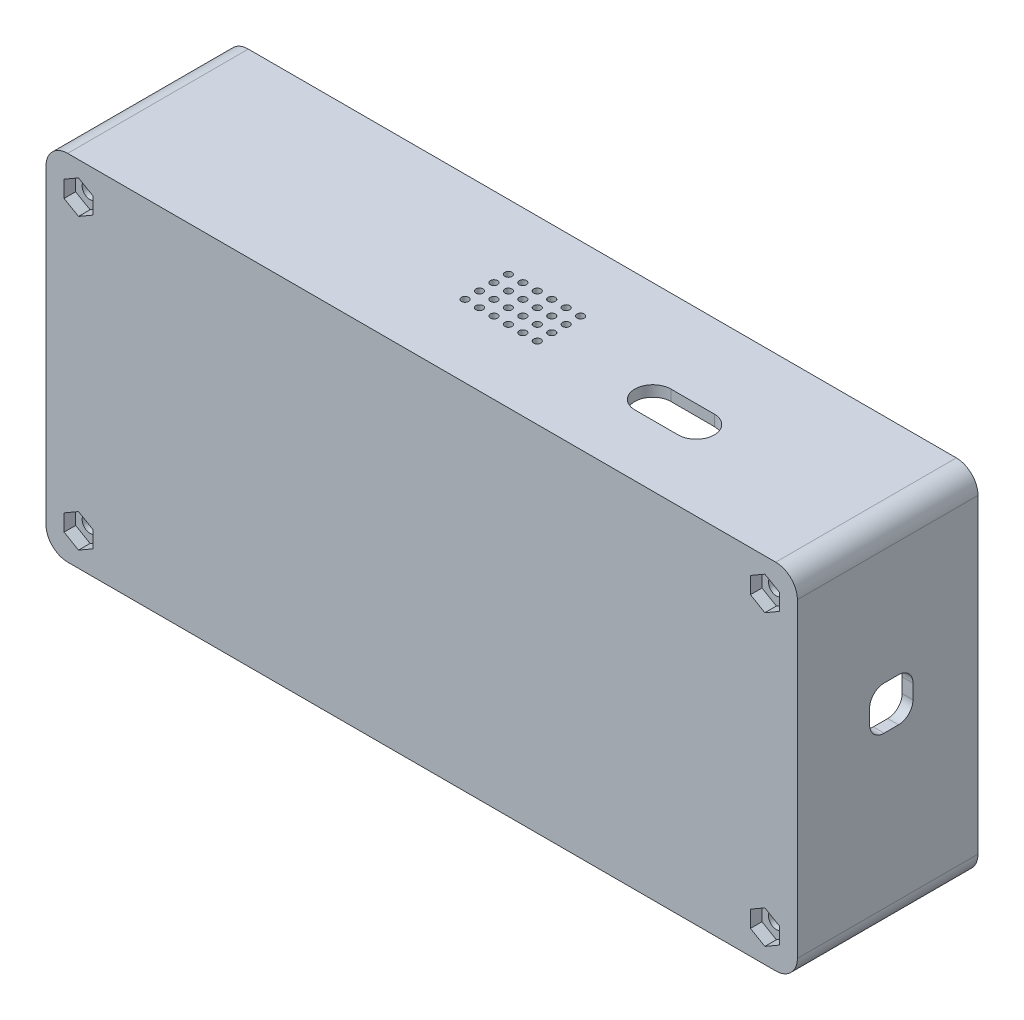
from build123d import *

# Parameters (mm, degrees)
SKETCH_1_W                  = 104
SKETCH_1_H                  = 49
SKETCH_1_R                  = 1.1
EXTRUDE_1_DEPTH             = 25
FILLET_1_R                  = 3
CUT_EXTRUDE_1_DEPTH         = 1.6
SHELL_2_DEPTH               = 23.5
SHELL_2_2_OUTLINE_R         = 2.6
SHELL_2_2_DEPTH             = 21.9
SKETCH_3_R                  = 2.6
SKETCH_3_R_2                = 1.1
CUT_EXTRUDE_2_DEPTH         = 17
CUT_EXTRUDE_3_DEPTH         = 17
CUT_EXTRUDE_4_DEPTH         = 110.732629605
CUT_EXTRUDE_4_DEPTH_BACK    = 110.732629605
SKETCH_6_W                  = 6
SKETCH_6_H                  = 6
SKETCH_7_W                  = 15
SKETCH_7_H                  = 7
CUT_EXTRUDE_5_DEPTH         = 17
SKETCH_8_W                  = 10
SKETCH_8_H                  = 2
EXTRUDE_2_DEPTH             = 3
FILLET_3_R                  = 2
FILLET_4_R                  = 2
SKETCH_10_R                 = 0.5
CUT_EXTRUDE_6_DEPTH         = 76.696763471
PATTERN_LINEAR_1_COUNT      = 4
PATTERN_LINEAR_1_PITCH      = 2
PATTERN_LINEAR_1_COUNT_DIR2 = 6
PATTERN_LINEAR_1_PITCH_DIR2 = 2


# Read off the part's stored shape, not the designer's step: 抽壳2
with BuildPart() as part:
    # 草图1 → 凸台-拉伸1 (new body)
    with BuildSketch(Plane.XY):
        Rectangle(SKETCH_1_W, SKETCH_1_H)
        with Locations((-47.5, 20)):
            Circle(SKETCH_1_R, mode=Mode.SUBTRACT)
        with Locations((47.5, 20)):
            Circle(SKETCH_1_R, mode=Mode.SUBTRACT)
        with Locations((47.5, -20)):
            Circle(SKETCH_1_R, mode=Mode.SUBTRACT)
        with Locations((-47.5, -20)):
            Circle(SKETCH_1_R, mode=Mode.SUBTRACT)
    extrude(amount=EXTRUDE_1_DEPTH)

    # 圆角1
    fillet_1_edges = [part.edges().sort_by_distance(p)[0] for p in [
        (-52, 24.5, 12.5),
        (52, 24.5, 12.5),
        (52, -24.5, 12.5),
        (-52, -24.5, 12.5),
    ]]
    fillet(fillet_1_edges, radius=FILLET_1_R)

    # 草图2 → 切除-拉伸1 (cut)
    with BuildSketch(Plane.XY.offset(25)):
        Polygon((-45.5, 18.845299462), (-45.5, 21.154700538), (-47.5, 22.309401077), (-49.5, 21.154700538), (-49.5, 18.845299462), (-47.5, 17.690598923), align=None)
        Polygon((-45.5, -18.845299462), (-45.5, -21.154700538), (-47.5, -22.309401077), (-49.5, -21.154700538), (-49.5, -18.845299462), (-47.5, -17.690598923), align=None)
        Polygon((49.5, 21.154700538), (49.5, 18.845299462), (47.5, 17.690598923), (45.5, 18.845299462), (45.5, 21.154700538), (47.5, 22.309401077), align=None)
        Polygon((49.5, -18.845299462), (47.5, -17.690598923), (45.5, -18.845299462), (45.5, -21.154700538), (47.5, -22.309401077), (49.5, -21.154700538), align=None)
    extrude(amount=-CUT_EXTRUDE_1_DEPTH, mode=Mode.SUBTRACT)

    # 抽壳2 outline → 抽壳2 (cut)
    with BuildSketch(Plane.XY):
        Polygon((-50.5, 17.690598923), (-50.5, -17.690598923), (-47.5, -15.958548116), (-44, -17.979274058), (-44, -22.020725942), (-45.696152423, -23), (45.696152423, -23), (44, -22.020725942), (44, -17.979274058), (47.5, -15.958548116), (50.5, -17.690598923), (50.5, 17.690598923), (47.5, 15.958548116), (44, 17.979274058), (44, 22.020725942), (45.696152423, 23), (-45.696152423, 23), (-44, 22.020725942), (-44, 17.979274058), (-47.5, 15.958548116), align=None)
        with BuildLine():
            Line((-49.396038713, -22.946773423), (-50.054923182, -22.566366298))
            ThreePointArc((-50.054923182, -22.566366298), (-49.75, -22.799038106), (-49.396038713, -22.946773423))
        make_face()
        with BuildLine():
            ThreePointArc((-49.396038713, 22.946773423), (-49.75, 22.799038106), (-50.054923182, 22.566366298))
            Line((-50.054923182, 22.566366298), (-49.396038713, 22.946773423))
        make_face()
        with BuildLine():
            Line((50.054923182, -22.566366298), (49.396038713, -22.946773423))
            ThreePointArc((49.396038713, -22.946773423), (49.75, -22.799038106), (50.054923182, -22.566366298))
        make_face()
        with BuildLine():
            ThreePointArc((50.054923182, 22.566366298), (49.75, 22.799038106), (49.396038713, 22.946773423))
            Line((49.396038713, 22.946773423), (50.054923182, 22.566366298))
        make_face()
    extrude(amount=SHELL_2_DEPTH, mode=Mode.SUBTRACT)

    # Shell 2 2 outline → Shell 2 2 (cut)
    # profile 1 of 4: a face of its own
    with BuildSketch(Plane.XY):
        with BuildLine():
            Line((-50.5, -17.690598923), (-50.5, -21.5))
            ThreePointArc((-50.5, -21.5), (-50.38426601, -22.077760862), (-50.054923182, -22.566366298))
            Line((-50.054923182, -22.566366298), (-49.396038713, -22.946773423))
            ThreePointArc((-49.396038713, -22.946773423), (-49.199799731, -22.986633804), (-49, -23))
            Line((-49, -23), (-45.696152423, -23))
            Line((-45.696152423, -23), (-44, -22.020725942))
            Line((-44, -22.020725942), (-44, -17.979274058))
            Line((-44, -17.979274058), (-47.5, -15.958548116))
            Line((-47.5, -15.958548116), (-50.5, -17.690598923))
        make_face()
        with Locations((-47.5, -20)):
            Circle(SHELL_2_2_OUTLINE_R, mode=Mode.SUBTRACT)
    # profile 2 of 4: a face of its own
    with BuildSketch(Plane.XY):
        with BuildLine():
            Line((-50.5, 21.5), (-50.5, 17.690598923))
            Line((-50.5, 17.690598923), (-47.5, 15.958548116))
            Line((-47.5, 15.958548116), (-44, 17.979274058))
            Line((-44, 17.979274058), (-44, 22.020725942))
            Line((-44, 22.020725942), (-45.696152423, 23))
            Line((-45.696152423, 23), (-49, 23))
            ThreePointArc((-49, 23), (-49.199799731, 22.986633804), (-49.396038713, 22.946773423))
            Line((-49.396038713, 22.946773423), (-50.054923182, 22.566366298))
            ThreePointArc((-50.054923182, 22.566366298), (-50.38426601, 22.077760862), (-50.5, 21.5))
        make_face()
        with Locations((-47.5, 20)):
            Circle(SHELL_2_2_OUTLINE_R, mode=Mode.SUBTRACT)
    # profile 3 of 4: a face of its own
    with BuildSketch(Plane.XY):
        with BuildLine():
            Line((44, -22.020725942), (45.696152423, -23))
            Line((45.696152423, -23), (49, -23))
            ThreePointArc((49, -23), (49.199799731, -22.986633804), (49.396038713, -22.946773423))
            Line((49.396038713, -22.946773423), (50.054923182, -22.566366298))
            ThreePointArc((50.054923182, -22.566366298), (50.38426601, -22.077760862), (50.5, -21.5))
            Line((50.5, -21.5), (50.5, -17.690598923))
            Line((50.5, -17.690598923), (47.5, -15.958548116))
            Line((47.5, -15.958548116), (44, -17.979274058))
            Line((44, -17.979274058), (44, -22.020725942))
        make_face()
        with Locations((47.5, -20)):
            Circle(SHELL_2_2_OUTLINE_R, mode=Mode.SUBTRACT)
    # profile 4 of 4: a face of its own
    with BuildSketch(Plane.XY):
        with BuildLine():
            Line((49, 23), (45.696152423, 23))
            Line((45.696152423, 23), (44, 22.020725942))
            Line((44, 22.020725942), (44, 17.979274058))
            Line((44, 17.979274058), (47.5, 15.958548116))
            Line((47.5, 15.958548116), (50.5, 17.690598923))
            Line((50.5, 17.690598923), (50.5, 21.5))
            ThreePointArc((50.5, 21.5), (50.38426601, 22.077760862), (50.054923182, 22.566366298))
            Line((50.054923182, 22.566366298), (49.396038713, 22.946773423))
            ThreePointArc((49.396038713, 22.946773423), (49.199799731, 22.986633804), (49, 23))
        make_face()
        with Locations((47.5, 20)):
            Circle(SHELL_2_2_OUTLINE_R, mode=Mode.SUBTRACT)
    extrude(amount=SHELL_2_2_DEPTH, mode=Mode.SUBTRACT)

    # 草图3 → 切除-拉伸2 (cut)
    # profile 1 of 4: a face of its own
    with BuildSketch(Plane(origin=(0, 0, 0), x_dir=(-1, 0, 0), z_dir=(0, 0, -1))):
        with Locations((-47.5, 20)):
            Circle(SKETCH_3_R)
        with Locations((-47.5, 20)):
            Circle(SKETCH_3_R_2, mode=Mode.SUBTRACT)
    # profile 2 of 4: a face of its own
    with BuildSketch(Plane(origin=(0, 0, 0), x_dir=(-1, 0, 0), z_dir=(0, 0, -1))):
        with Locations(Location((47.5, 20, 0), (0, 0, 180))):
            Circle(SKETCH_3_R)
        with Locations(Location((47.5, 20, 0), (0, 0, 180))):
            Circle(SKETCH_3_R_2, mode=Mode.SUBTRACT)
    # profile 3 of 4: a face of its own
    with BuildSketch(Plane(origin=(0, 0, 0), x_dir=(-1, 0, 0), z_dir=(0, 0, -1))):
        with Locations((47.5, -20)):
            Circle(SKETCH_3_R)
        with Locations((47.5, -20)):
            Circle(SKETCH_3_R_2, mode=Mode.SUBTRACT)
    # profile 4 of 4: a face of its own
    with BuildSketch(Plane(origin=(0, 0, 0), x_dir=(-1, 0, 0), z_dir=(0, 0, -1))):
        with Locations(Location((-47.5, -20, 0), (0, 0, 180))):
            Circle(SKETCH_3_R)
        with Locations(Location((-47.5, -20, 0), (0, 0, 180))):
            Circle(SKETCH_3_R_2, mode=Mode.SUBTRACT)
    extrude(amount=-CUT_EXTRUDE_2_DEPTH, mode=Mode.SUBTRACT)

    # 草图5 → 切除-拉伸3 (cut)
    with BuildSketch(Plane(origin=(0, 24.5, 0), x_dir=(1, 0, 0), z_dir=(0, 1, 0))):
        with BuildLine():
            Line((21, -11.5), (27, -11.5))
            ThreePointArc((27, -11.5), (29.5, -14), (27, -16.5))
            Line((27, -16.5), (21, -16.5))
            ThreePointArc((21, -16.5), (18.5, -14), (21, -11.5))
        make_face()
    extrude(amount=-CUT_EXTRUDE_3_DEPTH, mode=Mode.SUBTRACT)

    # 草图6 → 切除-拉伸4 (cut, two sides: drawn at the far end of the back side and taken through both)
    with BuildSketch(Plane(origin=(52, 0, 0), x_dir=(0, 0, -1), z_dir=(1, 0, 0)).offset(-CUT_EXTRUDE_4_DEPTH_BACK)):
        with Locations((-12, 2.5)):
            Rectangle(SKETCH_6_W, SKETCH_6_H)
    extrude(amount=CUT_EXTRUDE_4_DEPTH + CUT_EXTRUDE_4_DEPTH_BACK, mode=Mode.SUBTRACT)

    # 草图7 → 切除-拉伸5 (cut)
    with BuildSketch(Plane.XZ.offset(24.5)):
        with Locations((-27.5, 14.5)):
            Rectangle(SKETCH_7_W, SKETCH_7_H)
    extrude(amount=-CUT_EXTRUDE_5_DEPTH, mode=Mode.SUBTRACT)

    # 草图8 → 凸台-拉伸2 (add)
    with BuildSketch(Plane(origin=(0, 24.5, 0), x_dir=(1, 0, 0), z_dir=(0, 1, 0))):
        with Locations((-25, -8)):
            Rectangle(SKETCH_8_W, SKETCH_8_H)
    extrude_2 = extrude(amount=-EXTRUDE_2_DEPTH)

    # 镜向1: 凸台-拉伸2 across plane
    add(extrude_2.mirror(Plane.ZX))

    # 圆角3
    fillet_3_edges = [part.edges().sort_by_distance(p)[0] for p in [
        (51.25, 5.5, 9),
        (51.25, -0.5, 9),
        (51.25, -0.5, 15),
        (51.25, 5.5, 15),
    ]]
    fillet(fillet_3_edges, radius=FILLET_3_R)

    # 圆角4
    fillet_4_edges = [part.edges().sort_by_distance(p)[0] for p in [
        (-51.25, 5.5, 9),
        (-51.25, -0.5, 9),
        (-51.25, -0.5, 15),
        (-51.25, 5.5, 15),
    ]]
    fillet(fillet_4_edges, radius=FILLET_4_R)

    # 草图10 → 切除-拉伸6 (cut, symmetric)
    with BuildSketch(Plane.XZ.offset(24.5)):
        with Locations((-4, 9)):
            Circle(SKETCH_10_R)
    cut_extrude_6 = extrude(amount=CUT_EXTRUDE_6_DEPTH, both=True, mode=Mode.SUBTRACT)

    # 阵列(线性)1: Cut-Extrude 6 4 × 6
    with Locations(*[(j * PATTERN_LINEAR_1_PITCH_DIR2, 0, i * PATTERN_LINEAR_1_PITCH) for i in range(PATTERN_LINEAR_1_COUNT) for j in range(PATTERN_LINEAR_1_COUNT_DIR2) if (i, j) != (0, 0)]):
        add(cut_extrude_6, mode=Mode.SUBTRACT)


solid = part.part
